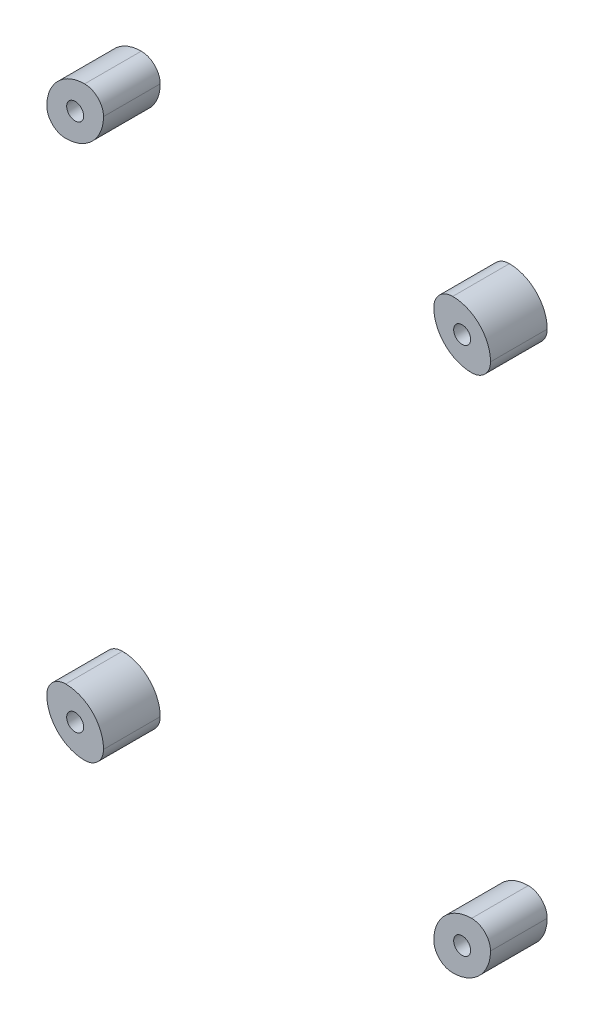
from build123d import *

# Parameters (mm, degrees)
BOSS_EXTRU_1_DEPTH  = 15
D_GAGEMENT_M41_D    = 4.5
SYM_TRIE1_OUTLINE_R = 2.25
SYM_TRIE1_DEPTH     = 15


# Read off the part's stored shape, not the designer's step: Symétrie1
with BuildPart() as part:
    # Esquisse1 → Boss.-Extru.1 (new body)
    with BuildSketch(Plane.XY):
        with BuildLine():
            ThreePointArc((48.696481526, 0), (45.16094762, -1.464466094), (43.696481526, -5))
            ThreePointArc((43.696481526, -5), (46.625413714, -12.071067812), (53.696481526, -15))
            ThreePointArc((53.696481526, -15), (57.232015432, -13.535533906), (58.696481526, -10))
            ThreePointArc((58.696481526, -10), (55.767549338, -2.928932188), (48.696481526, 0))
        make_face()
    extrude(amount=BOSS_EXTRU_1_DEPTH)

    # Dégagement M41 (through all)
    with Locations(Plane.XY.offset(15)):
        with Locations((51.196481526, -7.5)):
            Hole(D_GAGEMENT_M41_D / 2)


with BuildPart() as body_2:
    # Symétrie1 outline → Symétrie1 (new body)
    # profile 1 of 3: a face of its own
    with BuildSketch(Plane.XY):
        with BuildLine():
            ThreePointArc((-58.696481526, -145), (-55.767549338, -152.071067812), (-48.696481526, -155))
            ThreePointArc((-48.696481526, -155), (-45.16094762, -153.535533906), (-43.696481526, -150))
            ThreePointArc((-43.696481526, -150), (-46.625413714, -142.928932188), (-53.696481526, -140))
            ThreePointArc((-53.696481526, -140), (-57.232015432, -141.464466094), (-58.696481526, -145))
        make_face()
        with Locations((-51.196481526, -147.5)):
            Circle(SYM_TRIE1_OUTLINE_R, mode=Mode.SUBTRACT)
    # profile 2 of 3: a face of its own
    with BuildSketch(Plane.XY):
        with BuildLine():
            ThreePointArc((-48.696481526, 0), (-55.767549338, -2.928932188), (-58.696481526, -10))
            ThreePointArc((-58.696481526, -10), (-57.232015432, -13.535533906), (-53.696481526, -15))
            ThreePointArc((-53.696481526, -15), (-46.625413714, -12.071067812), (-43.696481526, -5))
            ThreePointArc((-43.696481526, -5), (-45.16094762, -1.464466094), (-48.696481526, 0))
        make_face()
        with Locations((-51.196481526, -7.5)):
            Circle(SYM_TRIE1_OUTLINE_R, mode=Mode.SUBTRACT)
    # profile 3 of 3: a face of its own
    with BuildSketch(Plane.XY):
        with BuildLine():
            ThreePointArc((48.696481526, -155), (55.767549338, -152.071067812), (58.696481526, -145))
            ThreePointArc((58.696481526, -145), (57.232015432, -141.464466094), (53.696481526, -140))
            ThreePointArc((53.696481526, -140), (46.625413714, -142.928932188), (43.696481526, -150))
            ThreePointArc((43.696481526, -150), (45.16094762, -153.535533906), (48.696481526, -155))
        make_face()
        with Locations((51.196481526, -147.5)):
            Circle(SYM_TRIE1_OUTLINE_R, mode=Mode.SUBTRACT)
    extrude(amount=SYM_TRIE1_DEPTH)


solid = Compound([part.part, body_2.part])
